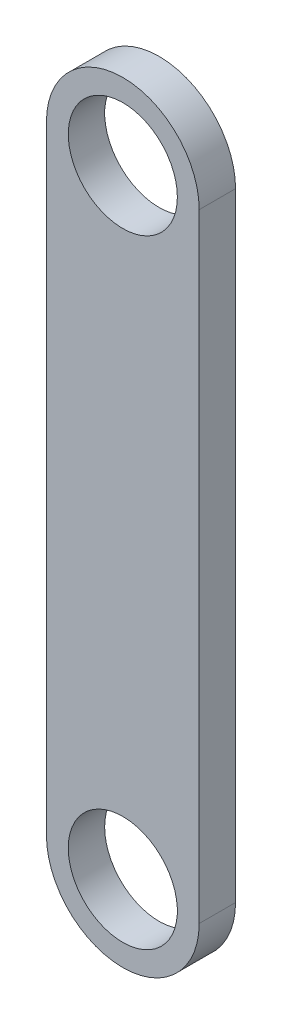
from build123d import *

# Parameters (mm, degrees)
SKETCH_SWINGING_ARM_R = 7.5
SWINGING_ARM_DEPTH    = 5


with BuildPart() as part:
    # Sketch_Swinging Arm → Swinging Arm (new body)
    with BuildSketch(Plane.XY):
        with BuildLine():
            Line((-10.5, 42.5), (-10.5, -42.5))
            ThreePointArc((-10.5, -42.5), (0, -53), (10.5, -42.5))
            Line((10.5, -42.5), (10.5, 42.5))
            ThreePointArc((10.5, 42.5), (0, 53), (-10.5, 42.5))
        make_face()
        with Locations((0, 42.5)):
            Circle(SKETCH_SWINGING_ARM_R, mode=Mode.SUBTRACT)
        with Locations((0, -42.5)):
            Circle(SKETCH_SWINGING_ARM_R, mode=Mode.SUBTRACT)
    extrude(amount=-SWINGING_ARM_DEPTH)


solid = part.part
